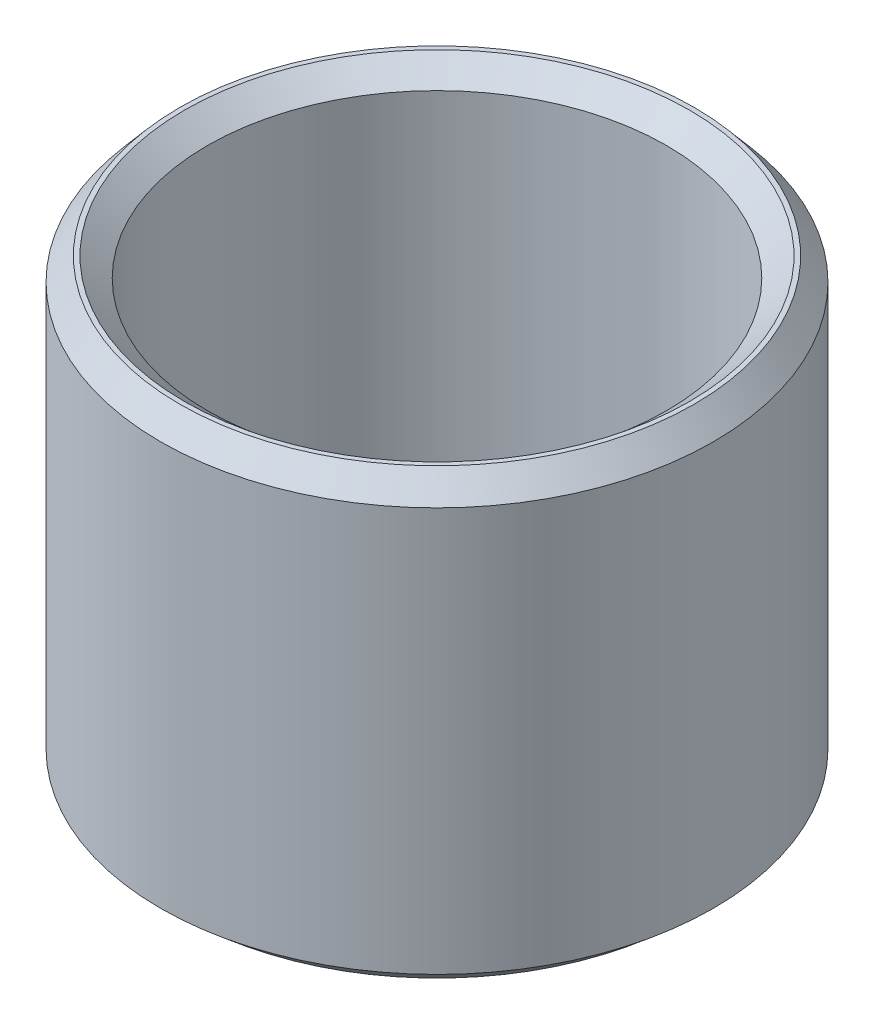
from build123d import *
from OCP.BRepFilletAPI import BRepFilletAPI_MakeChamfer

# Parameters (mm, degrees)
SKETCH1_R           = 42.5
BOSS_EXTRUDE1_DEPTH = 68.588226928
SKETCH2_R           = 35.304832023
CUT_EXTRUDE1_DEPTH  = 92.196737184
CHAMFER1_SIZE       = 3.504198196
CHAMFER1_SIZE2      = 2.969972619


with BuildPart() as part:
    # Sketch1 → Boss-Extrude1 (new body)
    with BuildSketch(Plane(origin=(0, 0, 0), x_dir=(1, 0, 0), z_dir=(0, 1, 0))):
        Circle(SKETCH1_R)
    extrude(amount=BOSS_EXTRUDE1_DEPTH)

    # Sketch2 → Cut-Extrude1 (cut, through all)
    with BuildSketch(Plane(origin=(0, 0, 0), x_dir=(1, 0, 0), z_dir=(0, 1, 0))):
        Circle(SKETCH2_R)
    extrude(amount=CUT_EXTRUDE1_DEPTH, mode=Mode.SUBTRACT)

    # Chamfer1: one chamfer whose edges measure the first distance from different faces: ONE call of the kernel's chamfer builder (chamfer() names one face for all edges)
    chamfer1_edges_1 = [part.edges().sort_by_distance(p)[0] for p in [
        (-35.304832023, 68.588226928, 0),
    ]]
    chamfer1_side_1 = [part.faces().sort_by_distance(p)[0] for p in [
        (-41.297918472, 68.588226928, 0),
    ]]
    chamfer1_edges_2 = [part.edges().sort_by_distance(p)[0] for p in [
        (-35.304832023, 0, 0),
    ]]
    chamfer1_side_2 = [part.faces().sort_by_distance(p)[0] for p in [
        (-35.304832023, 34.294113464, 0),
    ]]
    chamfer1_edges_3 = [part.edges().sort_by_distance(p)[0] for p in [
        (-42.5, 0, 0),
    ]]
    chamfer1_side_3 = [part.faces().sort_by_distance(p)[0] for p in [
        (-41.297918472, 0, 0),
    ]]
    chamfer1_edges_4 = [part.edges().sort_by_distance(p)[0] for p in [
        (-42.5, 68.588226928, 0),
    ]]
    chamfer1_side_4 = [part.faces().sort_by_distance(p)[0] for p in [
        (-42.5, 34.294113464, 0),
    ]]
    chamfer1 = BRepFilletAPI_MakeChamfer(part.part.solid().wrapped)
    for e in chamfer1_edges_1:
        chamfer1.Add(CHAMFER1_SIZE, CHAMFER1_SIZE2, e.wrapped, chamfer1_side_1[0].wrapped)  # the first distance lies on this face
    for e in chamfer1_edges_2:
        chamfer1.Add(CHAMFER1_SIZE, CHAMFER1_SIZE2, e.wrapped, chamfer1_side_2[0].wrapped)  # the first distance lies on this face
    for e in chamfer1_edges_3:
        chamfer1.Add(CHAMFER1_SIZE, CHAMFER1_SIZE2, e.wrapped, chamfer1_side_3[0].wrapped)  # the first distance lies on this face
    for e in chamfer1_edges_4:
        chamfer1.Add(CHAMFER1_SIZE, CHAMFER1_SIZE2, e.wrapped, chamfer1_side_4[0].wrapped)  # the first distance lies on this face
    add(Compound.cast(chamfer1.Shape()), mode=Mode.REPLACE)


solid = part.part
